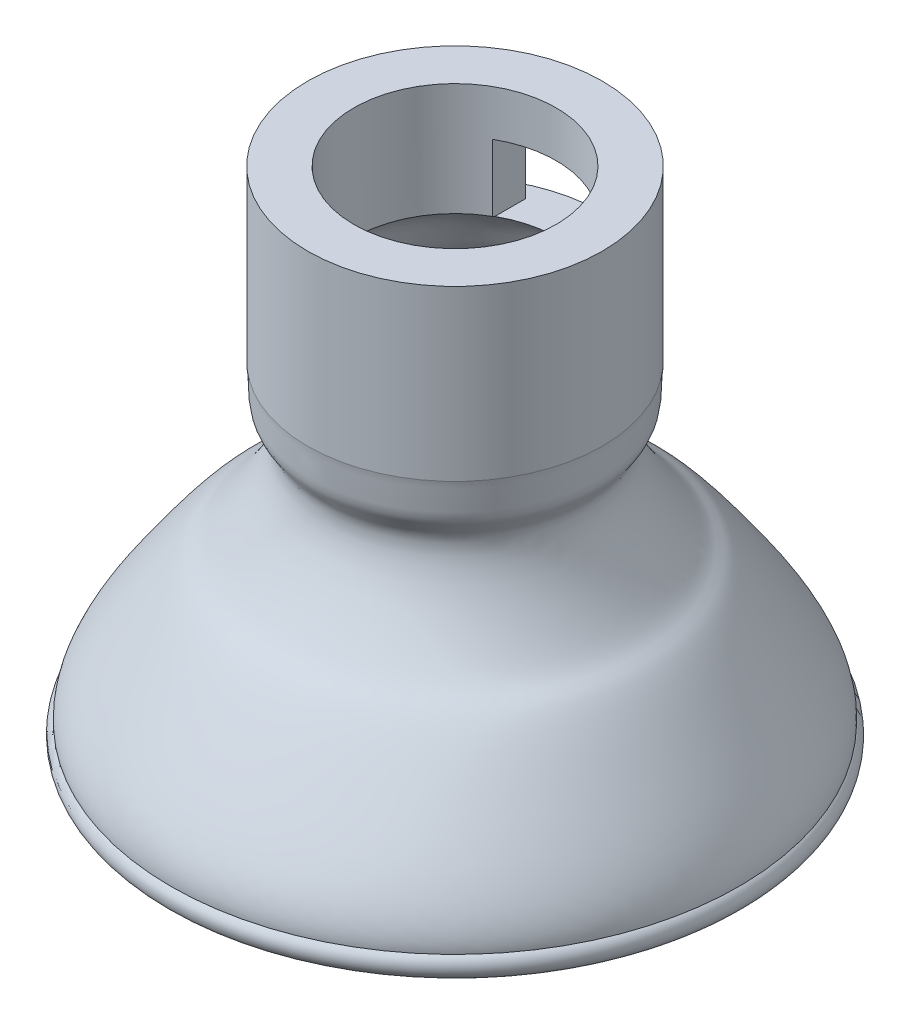
from build123d import *

# Parameters (mm, degrees)
ESBO_O2_W                  = 8.52075949
ESBO_O2_H                  = 5.764043184
CORTE_EXTRUS_O1_DEPTH      = 21
CORTE_EXTRUS_O2_DEPTH      = 21
CORTE_EXTRUS_O2_DEPTH_BACK = 21
ESBO_O3_W                  = 2.243810292
ESBO_O3_H                  = 5.764043184


with BuildPart() as part:
    # Esboço1 → Revolução1 (revolve)
    with BuildSketch(Plane.XY):
        with BuildLine():
            Line((12.493596339, 41.646579704), (12.493596339, 41.459883591))
            add(Edge.make_bspline(
                [(12.493596339, 41.459883591), (12.301263403, 40.198437894), (12.672676028, 38.232307085), (9.898226855, 35.869637873), (14.859497628, 27.808367469), (16.089859378, 28.020832476), (19.354182401, 24.142981418), (24.256577419, 16.859591957), (24.078601749, 14.91422611)],
                knots=[0, 0, 0, 0, 0.101004703, 0.175039834, 0.372875088, 0.603292123, 0.835962091, 1, 1, 1, 1], degree=3))
            ThreePointArc((24.078601749, 14.91422611), (23.296290883, 12.948863246), (22.883592364, 15.023553924))
            add(Edge.make_bspline(
                [(11.307306068, 41.640757561), (11.273508042, 41.419087908), (11.225101504, 40.957376107), (11.193026279, 40.152209665), (11.194025164, 39.304088475), (11.110574296, 38.777078707), (11.029809991, 38.585113078), (10.875626346, 38.330661384), (10.632782714, 37.993206106), (10.337880773, 37.554240715), (10.043589267, 36.9656871), (9.826027372, 36.007636699), (9.914556574, 34.890335952), (10.296489153, 33.575292999), (10.86389191, 32.293618099), (11.759071388, 30.664468375), (12.946367341, 28.919920551), (13.948802762, 27.69653267), (14.801409404, 26.960382807), (15.418667293, 26.577059231), (15.841844965, 26.255748079), (16.589552393, 25.48932973), (17.62963193, 24.220510979), (19.000727557, 22.369544481), (20.544370852, 20.200784471), (21.712928806, 18.335896373), (22.302975554, 17.206719637), (22.637852499, 16.382278959), (22.808730433, 15.829198344), (22.890769285, 15.346757355), (22.894284366, 15.140423019), (22.883592364, 15.023553924)],
                knots=[0, 0, 0, 0, 0.015625, 0.03125, 0.0625, 0.09375, 0.109375, 0.125, 0.140625, 0.15625, 0.171875, 0.1875, 0.21875, 0.25, 0.28125, 0.3125, 0.375, 0.4375, 0.5, 0.5625, 0.625, 0.6875, 0.75, 0.8125, 0.875, 0.90625, 0.9375, 0.953125, 0.96875, 0.984375, 1, 1, 1, 1], degree=3))
            add(Edge.make_bspline(
                [(11.307306068, 41.640757561), (10.493329038, 43.239681157), (10.332192588, 45.29403191), (8.575926678, 46.236967031)],
                knots=[0, 0, 0, 0, 1, 1, 1, 1], degree=3))
            Line((8.575926678, 46.236967031), (8.575926678, 55.780385677))
            Line((8.575926678, 55.780385677), (12.493596339, 55.780385677))
            Line((12.493596339, 55.780385677), (12.493596339, 46.236967031))
            Line((12.493596339, 46.236967031), (12.493596339, 41.646579704))
        make_face()
    revolve(axis=Axis((0, 44.517371893, 0), (0, -1, 0)))

    # Esboço2 → Corte-extrusão1 (cut)
    with BuildSketch(Plane.XY):
        with Locations((0, 49.017313479)):
            Rectangle(ESBO_O2_W, ESBO_O2_H)
    extrude(amount=-CORTE_EXTRUS_O1_DEPTH, mode=Mode.SUBTRACT)

    # Esboço3 → Corte-extrusão2 (cut, two sides: drawn at the far end of the back side and taken through both)
    with BuildSketch(Plane(origin=(0, 0, 0), x_dir=(0, 0, -1), z_dir=(1, 0, 0)).offset(-CORTE_EXTRUS_O2_DEPTH_BACK)):
        with Locations((11.371691193, 49.017313479)):
            Rectangle(ESBO_O3_W, ESBO_O3_H)
    extrude(amount=CORTE_EXTRUS_O2_DEPTH + CORTE_EXTRUS_O2_DEPTH_BACK, mode=Mode.SUBTRACT)


solid = part.part
